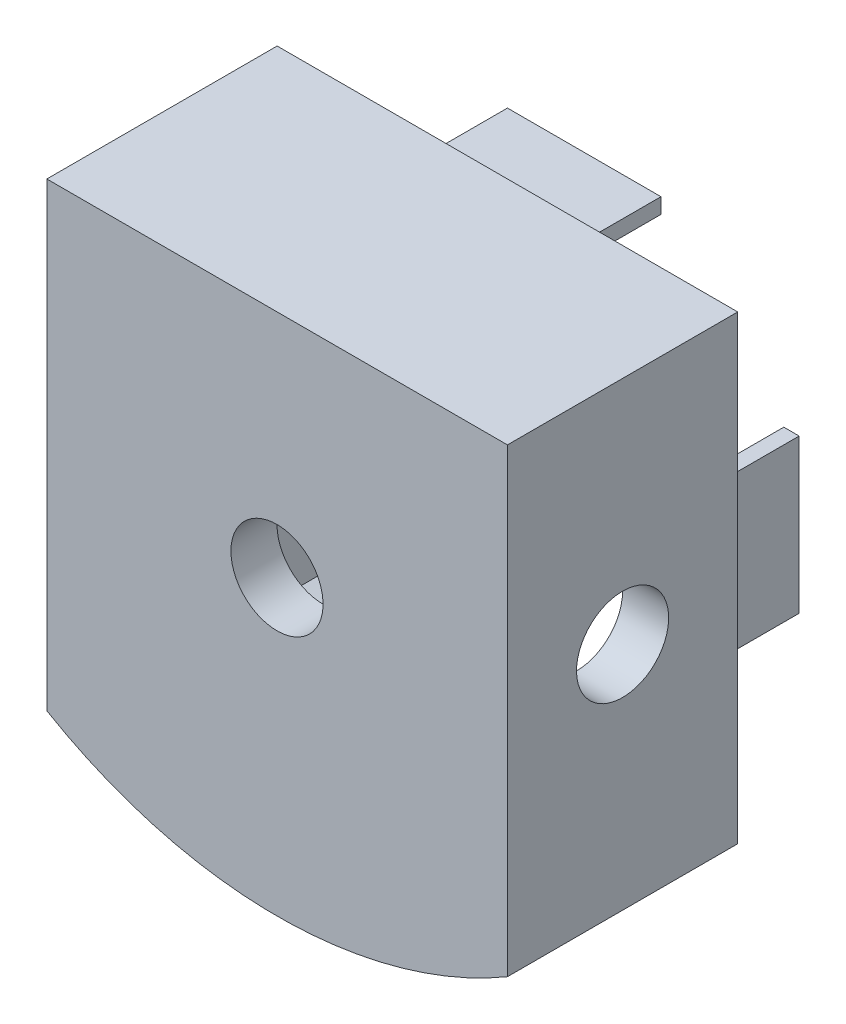
from build123d import *

# Parameters (mm, degrees)
BOSS_EXTRUDE1_DEPTH = 15
SHELL13_T           = -3
SKETCH3_R           = 3
CUT_EXTRUDE2_DEPTH  = 3
SKETCH4_W           = 10
SKETCH4_H           = 1
SKETCH4_W_2         = 1
SKETCH4_H_2         = 10
SKETCH4_W_3         = 7
BOSS_EXTRUDE2_DEPTH = 5
SKETCH5_R           = 3
CUT_EXTRUDE3_DEPTH  = 30


with BuildPart() as part:
    # Sketch1 → Boss-Extrude1 (new body)
    with BuildSketch(Plane.XY):
        with BuildLine():
            Line((15, -15), (15, 15))
            Line((15, 15), (-15, 15))
            Line((-15, 15), (-15, -15))
            ThreePointArc((-15, -15), (0, -19.084367335), (15, -15))
        make_face()
    extrude(amount=BOSS_EXTRUDE1_DEPTH)

    # Shell13
    shell13_openings = [part.faces().sort_by_distance(p)[0] for p in [
        (0, -1.403561753, 0),
    ]]
    offset(amount=SHELL13_T, openings=shell13_openings, kind=Kind.INTERSECTION)

    # Sketch3 → Cut-Extrude2 (cut)
    with BuildSketch(Plane(origin=(0, 0, 12), x_dir=(-1, 0, 0), z_dir=(0, 0, -1))):
        with Locations((0.010259738, 0.007572697)):
            Circle(SKETCH3_R)
    extrude(amount=-CUT_EXTRUDE2_DEPTH, mode=Mode.SUBTRACT)

    # Sketch4 → Boss-Extrude2 (add)
    with BuildSketch(Plane(origin=(0, 0, 0), x_dir=(-1, 0, 0), z_dir=(0, 0, -1))):
        with Locations((0, 13.5)):
            Rectangle(SKETCH4_W, SKETCH4_H)
        with Locations((-13.5, 0)):
            Rectangle(SKETCH4_W_2, SKETCH4_H_2)
        with Locations((0, -17.5)):
            Rectangle(SKETCH4_W_3, SKETCH4_H)
        with Locations((13.5, 0)):
            Rectangle(SKETCH4_W_2, SKETCH4_H_2)
    extrude(amount=BOSS_EXTRUDE2_DEPTH)

    # Sketch5 → Cut-Extrude3 (cut)
    with BuildSketch(Plane(origin=(15, 0, 0), x_dir=(0, 0, -1), z_dir=(1, 0, 0))):
        with Locations((-7.5, 0)):
            Circle(SKETCH5_R)
    extrude(amount=-CUT_EXTRUDE3_DEPTH, mode=Mode.SUBTRACT)


solid = part.part
